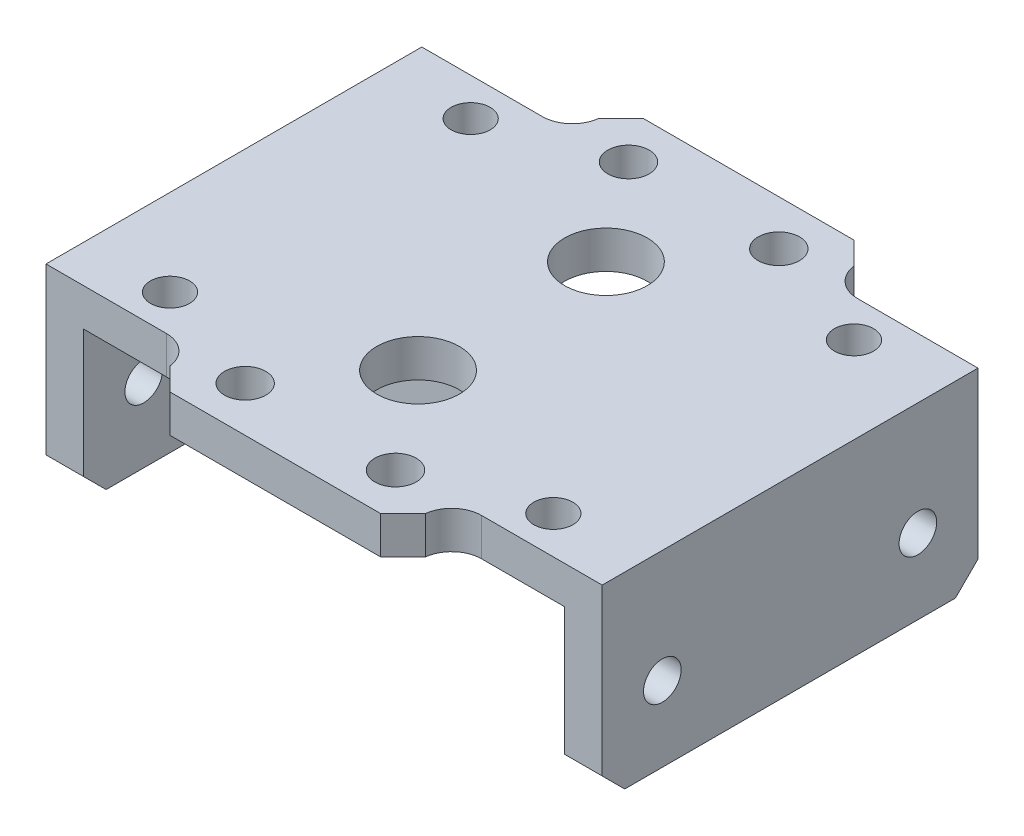
from build123d import *

# Parameters (mm, degrees)
BOSS_EXTRUDE1_DEPTH = 50
SKETCH2_R           = 2.5
CUT_EXTRUDE1_DEPTH  = 100
CHAMFER1_SIZE       = 3
SKETCH3_R           = 2.6
CUT_EXTRUDE2_DEPTH  = 93.741576437
SKETCH6_R           = 5.5
CUT_EXTRUDE3_DEPTH  = 93.741576437
SKETCH7_W           = 74
SKETCH7_H           = 5
BOSS_EXTRUDE2_DEPTH = 20
FILLET1_R           = 4
SKETCH8_W           = 34
SKETCH8_H           = 6.5
BOSS_EXTRUDE3_DEPTH = 5
SKETCH9_R           = 2.75
CUT_EXTRUDE4_DEPTH  = 97.401504138
CHAMFER2_SIZE       = 3
FILLET2_R           = 4


with BuildPart() as part:
    # Sketch1 → Boss-Extrude1 (new body)
    with BuildSketch(Plane.XY):
        Polygon((0, 0), (0, 25), (74, 25), (74, 0), (69, 0), (69, 20), (5, 20), (5, 0), align=None)
    extrude(amount=BOSS_EXTRUDE1_DEPTH)

    # Sketch2 → Cut-Extrude1 (cut, symmetric)
    with BuildSketch(Plane(origin=(5, 0, 0), x_dir=(0, 0, -1), z_dir=(1, 0, 0))):
        with Locations((-42, 10)):
            Circle(SKETCH2_R)
        with Locations((-8, 10)):
            Circle(SKETCH2_R)
    extrude(amount=CUT_EXTRUDE1_DEPTH, both=True, mode=Mode.SUBTRACT)

    # Chamfer1
    chamfer1_edges = [part.edges().sort_by_distance(p)[0] for p in [
        (2.5, 0, 0),
        (71.5, 0, 50),
        (2.5, 0, 50),
        (71.5, 0, 0),
    ]]
    chamfer(chamfer1_edges, length=CHAMFER1_SIZE)

    # Sketch3 → Cut-Extrude2 (cut, through all)
    with BuildSketch(Plane(origin=(0, 25, 0), x_dir=(1, 0, 0), z_dir=(0, 1, 0))):
        with Locations(Location((11.5, -45, 0), (0, 0, 180))):
            Circle(SKETCH3_R)
        with Locations(Location((62.5, -45, 0), (0, 0, 180))):
            Circle(SKETCH3_R)
        with Locations(Location((62.5, -5, 0), (0, 0, 180))):
            Circle(SKETCH3_R)
        with Locations(Location((11.5, -5, 0), (0, 0, 180))):
            Circle(SKETCH3_R)
    extrude(amount=-CUT_EXTRUDE2_DEPTH, mode=Mode.SUBTRACT)

    # Sketch6 → Cut-Extrude3 (cut, through all)
    with BuildSketch(Plane(origin=(0, 25, 0), x_dir=(1, 0, 0), z_dir=(0, 1, 0))):
        with Locations(Location((37, -37.5, 0), (0, 0, 180))):
            Circle(SKETCH6_R)
        with Locations(Location((37, -12.5, 0), (0, 0, 180))):
            Circle(SKETCH6_R)
    extrude(amount=-CUT_EXTRUDE3_DEPTH, mode=Mode.SUBTRACT)

    # Sketch7 → Boss-Extrude2 (add)
    with BuildSketch(Plane.XZ):
        with Locations((37, 25)):
            Rectangle(SKETCH7_W, SKETCH7_H)
    extrude(amount=-BOSS_EXTRUDE2_DEPTH)

    # Fillet1
    fillet1_edges = [part.edges().sort_by_distance(p)[0] for p in [
        (5, 10, 22.5),
        (5, 10, 27.5),
        (69, 10, 22.5),
        (69, 10, 27.5),
    ]]
    fillet(fillet1_edges, radius=FILLET1_R)

    # Sketch8 → Boss-Extrude3 (add)
    with BuildSketch(Plane(origin=(0, 25, 0), x_dir=(1, 0, 0), z_dir=(0, 1, 0))):
        with Locations((37, 3.25)):
            Rectangle(SKETCH8_W, SKETCH8_H)
    boss_extrude3 = extrude(amount=-BOSS_EXTRUDE3_DEPTH)

    # Mirror1: Boss-Extrude3 across plane
    add(boss_extrude3.mirror(Plane.XY.offset(25)))

    # Sketch9 → Cut-Extrude4 (cut, through all)
    with BuildSketch(Plane(origin=(0, 25, 0), x_dir=(1, 0, 0), z_dir=(0, 1, 0))):
        with Locations(Location((27, 0.5, 0), (0, 0, 180))):
            Circle(SKETCH9_R)
        with Locations(Location((47, 0.5, 0), (0, 0, 180))):
            Circle(SKETCH9_R)
        with Locations(Location((27, -50.5, 0), (0, 0, 180))):
            Circle(SKETCH9_R)
        with Locations(Location((47, -50.5, 0), (0, 0, 180))):
            Circle(SKETCH9_R)
    extrude(amount=-CUT_EXTRUDE4_DEPTH, mode=Mode.SUBTRACT)

    # Chamfer2
    chamfer2_edges = [part.edges().sort_by_distance(p)[0] for p in [
        (20, 22.5, -6.5),
        (54, 22.5, -6.5),
        (20, 22.5, 56.5),
        (54, 22.5, 56.5),
    ]]
    chamfer(chamfer2_edges, length=CHAMFER2_SIZE)

    # Fillet2
    # the kernel refuses this fillet: 4 mm, written as the material it adds along each edge
    with BuildSketch(Plane(origin=(20, 25, 50), x_dir=(-1, 0, 0), z_dir=(0, -1, 0))) as fillet2_piece_1:
        with BuildLine():
            CenterArc((3.968626967, -4), FILLET2_R, 90, 82.819244219)
            Line((0, -3.5), (-0.079372539, -3.49))
            ThreePointArc((-0.079372539, -3.49), (-0.08, -1.75), (-0.08, 0))
            Line((-0.08, 0), (0, 0.08))
            Line((0, 0.08), (3.968626967, 0.08))
            Line((3.968626967, 0.08), (3.968626967, 0))
        make_face()
    extrude(amount=5)
    with BuildSketch(Plane(origin=(54, 25, 50), x_dir=(1, 0, 0), z_dir=(0, -1, 0))) as fillet2_piece_2:
        with BuildLine():
            CenterArc((3.968626967, 4), FILLET2_R, 187.180755781, 82.819244219)
            Line((0, 3.5), (-0.079372539, 3.49))
            ThreePointArc((-0.079372539, 3.49), (-0.08, 1.75), (-0.08, 0))
            Line((-0.08, 0), (0, -0.08))
            Line((0, -0.08), (3.968626967, -0.08))
            Line((3.968626967, -0.08), (3.968626967, 0))
        make_face()
    extrude(amount=5)
    with BuildSketch(Plane(origin=(54, 25, 0), x_dir=(0, 0, -1), z_dir=(0, -1, 0))) as fillet2_piece_3:
        with BuildLine():
            CenterArc((4, 3.968626967), FILLET2_R, 180, 82.819244219)
            Line((0, 3.968626967), (-0.08, 3.968626967))
            Line((-0.08, 3.968626967), (-0.08, 0))
            Line((-0.08, 0), (0, -0.08))
            ThreePointArc((0, -0.08), (1.75, -0.08), (3.49, -0.079372539))
            Line((3.49, -0.079372539), (3.5, 0))
        make_face()
    extrude(amount=5)
    with BuildSketch(Plane(origin=(20, 25, 0), x_dir=(0, 0, -1), z_dir=(0, -1, 0))) as fillet2_piece_4:
        with BuildLine():
            CenterArc((4, -3.968626967), FILLET2_R, 97.180755781, 82.819244219)
            Line((0, -3.968626967), (-0.08, -3.968626967))
            Line((-0.08, -3.968626967), (-0.08, 0))
            Line((-0.08, 0), (0, 0.08))
            ThreePointArc((0, 0.08), (1.75, 0.08), (3.49, 0.079372539))
            Line((3.49, 0.079372539), (3.5, 0))
        make_face()
    extrude(amount=5)


solid = part.part
